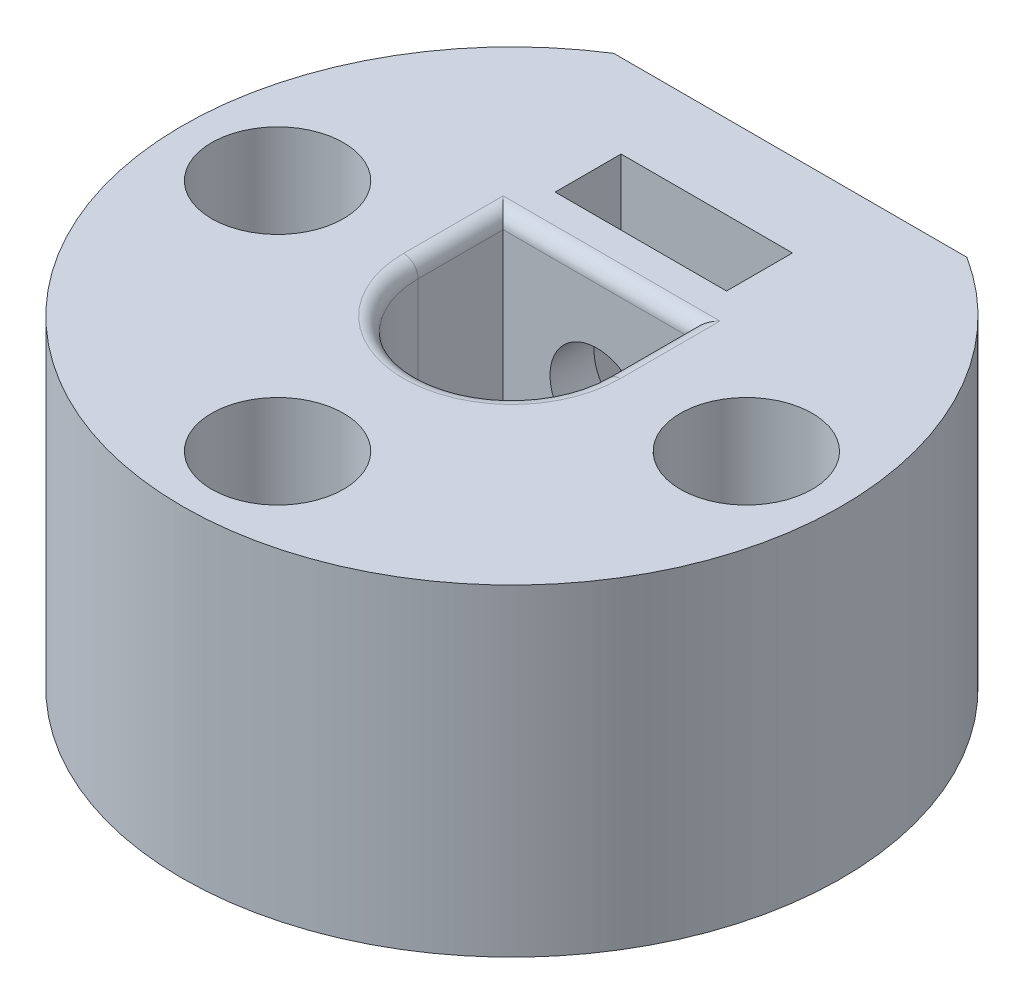
from build123d import *

# Parameters (mm, degrees)
BOSS_EXTRU_1_DEPTH                              = 8
CONG_1_R                                        = 0.5
ESQUISSE6_R                                     = 1.6
ENL_V_MAT_EXTRU_1_DEPTH                         = 18.808003863
ESQUISSE7_W                                     = 5.85
ESQUISSE7_H                                     = 2.25
ENL_V_MAT_EXTRU_2_DEPTH                         = 18.808003863
BOSS_EXTRU_2_START                              = 3
BOSS_EXTRU_2_DEPTH                              = 3
CHAMBRAGE_POUR_VIS_T_TE_CYLINDRIQUE_D           = 2.5
CHAMBRAGE_POUR_VIS_T_TE_CYLINDRIQUE_CBORE_D     = 4.5
CHAMBRAGE_POUR_VIS_T_TE_CYLINDRIQUE_CBORE_DEPTH = 5.3
ESQUISSE14_R                                    = 4.25
ENL_V_MAT_EXTRU_3_DEPTH                         = 2


with BuildPart() as part:
    # Esquisse1 → Boss.-Extru.1 (new body)
    with BuildSketch(Plane(origin=(0, 0, 0), x_dir=(1, 0, 0), z_dir=(0, 1, 0))):
        with BuildLine():
            Line((6.025985397, 9.5), (-6.025985397, 9.5))
            ThreePointArc((-6.025985397, 9.5), (0, -11.25), (6.025985397, 9.5))
        make_face()
        with BuildLine():
            Line((-3.2, 0), (-3.2, 2.9))
            Line((-3.2, 2.9), (3.2, 2.9))
            Line((3.2, 2.9), (3.2, 0))
            ThreePointArc((3.2, 0), (0, -3.2), (-3.2, 0))
        make_face(mode=Mode.SUBTRACT)
    extrude(amount=BOSS_EXTRU_1_DEPTH)

    # Congé1
    cong_1_edges = [part.edges().sort_by_distance(p)[0] for p in [
        (0, 8, 3.2),
        (-3.2, 8, -1.45),
        (3.2, 8, -1.45),
        (0, 8, -2.9),
    ]]
    fillet(cong_1_edges, radius=CONG_1_R)

    # Esquisse6 → Enlèv. mat.-Extru.1 (cut, through all)
    with BuildSketch(Plane.XY):
        with Locations((0, 4)):
            Circle(ESQUISSE6_R)
    extrude(amount=-ENL_V_MAT_EXTRU_1_DEPTH, mode=Mode.SUBTRACT)

    # Esquisse7 → Enlèv. mat.-Extru.2 (cut, through all)
    with BuildSketch(Plane(origin=(0, 0, 0), x_dir=(1, 0, 0), z_dir=(0, 1, 0))):
        with Locations((0, 5.525)):
            Rectangle(ESQUISSE7_W, ESQUISSE7_H)
    extrude(amount=ENL_V_MAT_EXTRU_2_DEPTH, mode=Mode.SUBTRACT)

    # Esquisse8 → Boss.-Extru.2 (add)
    with BuildSketch(Plane.XZ.offset(BOSS_EXTRU_2_START)):
        with BuildLine():
            Line((-6.025985397, -9.5), (6.025985397, -9.5))
            ThreePointArc((6.025985397, -9.5), (0, 11.25), (-6.025985397, -9.5))
        make_face()
    extrude(amount=-BOSS_EXTRU_2_DEPTH)

    # Chambrage pour vis à tête cylindrique à 6 pans creux (ou vis CHC) M21 (through all)
    with Locations(Plane(origin=(0, 8, 0), x_dir=(1, 0, 0), z_dir=(0, 1, 0))):
        with Locations((-8, 0), (0, -8), (8, 0)):
            CounterBoreHole(CHAMBRAGE_POUR_VIS_T_TE_CYLINDRIQUE_D / 2, CHAMBRAGE_POUR_VIS_T_TE_CYLINDRIQUE_CBORE_D / 2, CHAMBRAGE_POUR_VIS_T_TE_CYLINDRIQUE_CBORE_DEPTH)

    # Esquisse14 → Enlèv. mat.-Extru.3 (cut)
    with BuildSketch(Plane.XZ.offset(3)):
        Circle(ESQUISSE14_R)
    extrude(amount=-ENL_V_MAT_EXTRU_3_DEPTH, mode=Mode.SUBTRACT)


solid = part.part
